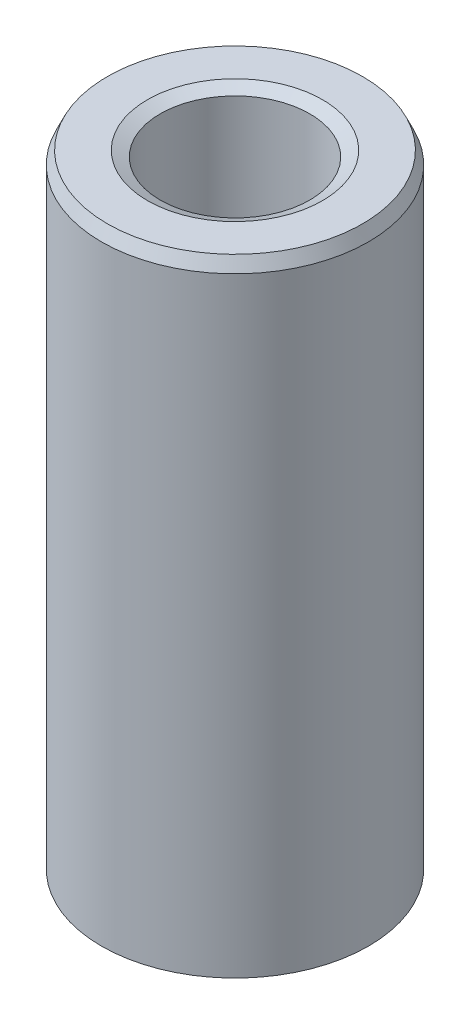
from build123d import *
from OCP.BRepFilletAPI import BRepFilletAPI_MakeChamfer

# Parameters (mm, degrees)
SKETCH1_R           = 20
BOSS_EXTRUDE1_DEPTH = 94.185941244
SKETCH2_R           = 11.206559487
CUT_EXTRUDE1_DEPTH  = 99.341199545
CHAMFER1_SIZE       = 1.908127074
CHAMFER1_SIZE2      = 0.878231751


with BuildPart() as part:
    # Sketch1 → Boss-Extrude1 (new body)
    with BuildSketch(Plane(origin=(0, 0, 0), x_dir=(1, 0, 0), z_dir=(0, 1, 0))):
        Circle(SKETCH1_R)
    extrude(amount=BOSS_EXTRUDE1_DEPTH)

    # Sketch2 → Cut-Extrude1 (cut, through all)
    with BuildSketch(Plane(origin=(0, 0, 0), x_dir=(1, 0, 0), z_dir=(0, 1, 0))):
        Circle(SKETCH2_R)
    extrude(amount=CUT_EXTRUDE1_DEPTH, mode=Mode.SUBTRACT)

    # Chamfer1: one chamfer whose edges measure the first distance from different faces: ONE call of the kernel's chamfer builder (chamfer() names one face for all edges)
    chamfer1_edges_1 = [part.edges().sort_by_distance(p)[0] for p in [
        (-11.206559487, 94.185941244, 0),
    ]]
    chamfer1_side_1 = [part.faces().sort_by_distance(p)[0] for p in [
        (-19.434314575, 94.185941244, 0),
    ]]
    chamfer1_edges_2 = [part.edges().sort_by_distance(p)[0] for p in [
        (-11.206559487, 0, 0),
    ]]
    chamfer1_side_2 = [part.faces().sort_by_distance(p)[0] for p in [
        (-11.206559487, 47.092970622, 0),
    ]]
    chamfer1_edges_3 = [part.edges().sort_by_distance(p)[0] for p in [
        (-20, 0, 0),
    ]]
    chamfer1_side_3 = [part.faces().sort_by_distance(p)[0] for p in [
        (-19.434314575, 0, 0),
    ]]
    chamfer1_edges_4 = [part.edges().sort_by_distance(p)[0] for p in [
        (-20, 94.185941244, 0),
    ]]
    chamfer1_side_4 = [part.faces().sort_by_distance(p)[0] for p in [
        (-20, 47.092970622, 0),
    ]]
    chamfer1 = BRepFilletAPI_MakeChamfer(part.part.solid().wrapped)
    for e in chamfer1_edges_1:
        chamfer1.Add(CHAMFER1_SIZE, CHAMFER1_SIZE2, e.wrapped, chamfer1_side_1[0].wrapped)  # the first distance lies on this face
    for e in chamfer1_edges_2:
        chamfer1.Add(CHAMFER1_SIZE, CHAMFER1_SIZE2, e.wrapped, chamfer1_side_2[0].wrapped)  # the first distance lies on this face
    for e in chamfer1_edges_3:
        chamfer1.Add(CHAMFER1_SIZE, CHAMFER1_SIZE2, e.wrapped, chamfer1_side_3[0].wrapped)  # the first distance lies on this face
    for e in chamfer1_edges_4:
        chamfer1.Add(CHAMFER1_SIZE, CHAMFER1_SIZE2, e.wrapped, chamfer1_side_4[0].wrapped)  # the first distance lies on this face
    add(Compound.cast(chamfer1.Shape()), mode=Mode.REPLACE)


solid = part.part
